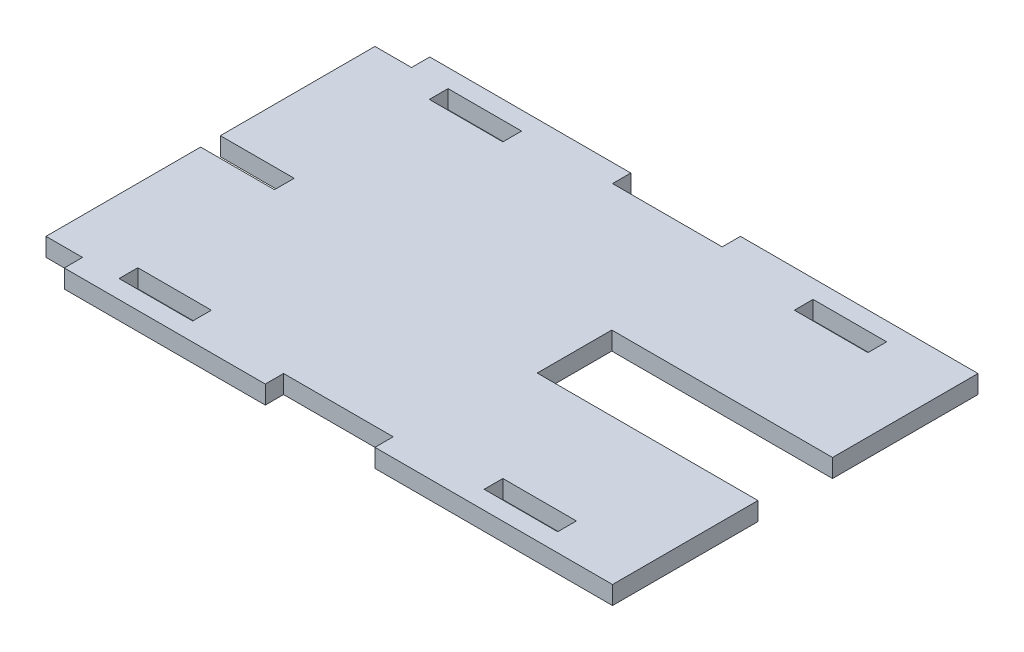
from build123d import *

# Parameters (mm, degrees)
BOSS_EXTRUDE1_DEPTH = 6.35
SKETCH4_W           = 25.5524
SKETCH4_H           = 6.5024
SKETCH4_W_2         = 12.7
SKETCH4_H_2         = 6.35
SKETCH4_W_3         = 38.1
CUT_EXTRUDE1_DEPTH  = 240.70724332


with BuildPart() as part:
    # Sketch1 → Boss-Extrude1 (new body)
    with BuildSketch(Plane(origin=(0, 0, 0), x_dir=(1, 0, 0), z_dir=(0, 1, 0))):
        Polygon((0, 60.071), (0, 0), (203.2, 0), (203.2, 50.546), (126.492, 50.546), (126.492, 76.454), (203.2, 76.454), (203.2, 127), (0, 127), (0, 66.929), (25.654, 66.929), (25.654, 60.071), align=None)
    extrude(amount=BOSS_EXTRUDE1_DEPTH)

    # Sketch4 → Cut-Extrude1 (cut, through all)
    with BuildSketch(Plane(origin=(0, 6.35, 0), x_dir=(1, 0, 0), z_dir=(0, 1, 0))):
        with Locations((38.1762, 117.3988)):
            Rectangle(SKETCH4_W, SKETCH4_H)
        with Locations((165.0238, 117.3988)):
            Rectangle(SKETCH4_W, SKETCH4_H)
        with Locations((38.1762, 9.6012)):
            Rectangle(SKETCH4_W, SKETCH4_H)
        with Locations((165.0238, 9.6012)):
            Rectangle(SKETCH4_W, SKETCH4_H)
        with Locations((6.35, 123.825)):
            Rectangle(SKETCH4_W_2, SKETCH4_H_2)
        with Locations((6.35, 3.175)):
            Rectangle(SKETCH4_W_2, SKETCH4_H_2)
        with Locations((101.6, 3.175)):
            Rectangle(SKETCH4_W_3, SKETCH4_H_2)
        with Locations((101.6, 123.825)):
            Rectangle(SKETCH4_W_3, SKETCH4_H_2)
    extrude(amount=-CUT_EXTRUDE1_DEPTH, mode=Mode.SUBTRACT)


solid = part.part
